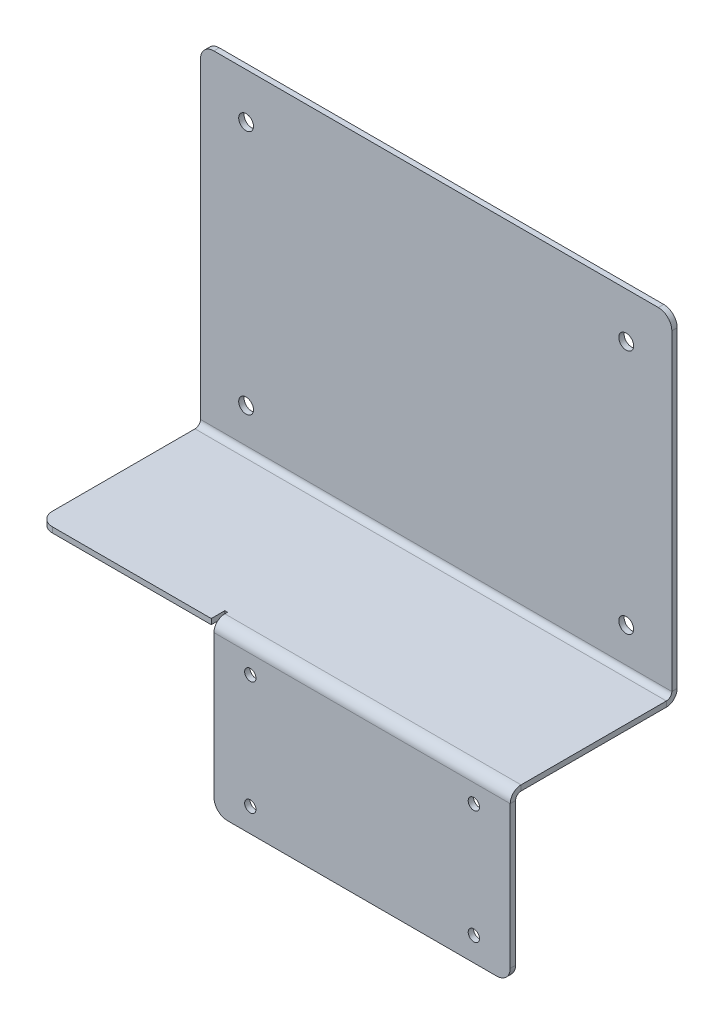
from build123d import *

# Parameters (mm, degrees)
SKETCH1_W                     = 175
SKETCH1_H                     = 125
SKETCH1_R                     = 2.75
BASE_FLANGE1_DEPTH            = 2
EDGE_FLANGE1_STRIP_W          = 12.06
EDGE_FLANGE1_STRIP_H          = 2
EDGE_FLANGE1_STRIP_CUT_DEPTH  = 175
EDGE_FLANGE1_DEPTH            = 175
EDGE_FLANGE3_STRIP_W          = 12.06
EDGE_FLANGE3_STRIP_H          = 2
EDGE_FLANGE3_STRIP_CUT_DEPTH  = 110
EDGE_FLANGE3_RELIEF_W         = 13.06
EDGE_FLANGE3_RELIEF_H         = 1
EDGE_FLANGE3_RELIEF_CUT_DEPTH = 2
EDGE_FLANGE3_DEPTH            = 110
CUT_EXTRUDE2_REACH            = 164.808
SKETCH18_R                    = 2.1
FILLET1_R                     = 5


# Sheet-metal steps are written as plain solids
with BuildPart() as part:
    # Sketch1 → Base-Flange1 (new body)
    with BuildSketch(Plane.XY):
        Rectangle(SKETCH1_W, SKETCH1_H)
        with Locations((70.5634, 45.5634)):
            Circle(SKETCH1_R, mode=Mode.SUBTRACT)
        with Locations((70.5634, -45.5634)):
            Circle(SKETCH1_R, mode=Mode.SUBTRACT)
        with Locations((-70.5634, 45.5634)):
            Circle(SKETCH1_R, mode=Mode.SUBTRACT)
        with Locations((-70.5634, -45.5634)):
            Circle(SKETCH1_R, mode=Mode.SUBTRACT)
    extrude(amount=BASE_FLANGE1_DEPTH)

    # Edge-Flange1 strip (across the edge) → Edge-Flange1 strip cut (cut)
    with BuildSketch(Plane(origin=(-87.5, -62.5, 2), x_dir=(0, 1, 0), z_dir=(1, 0, 0))):
        with Locations((-2, -1)):
            Rectangle(EDGE_FLANGE1_STRIP_W, EDGE_FLANGE1_STRIP_H)
    extrude(amount=EDGE_FLANGE1_STRIP_CUT_DEPTH, mode=Mode.SUBTRACT)

    # Edge-Flange1 section (across the edge) → Edge-Flange1 (add)
    with BuildSketch(Plane(origin=(-87.5, -62.5, 2), x_dir=(0, 1, 0), z_dir=(1, 0, 0))):
        with BuildLine():
            Line((0, 2.03), (0, 60))
            Line((0, 60), (2, 60))
            Line((2, 60), (2, 2.03))
            ThreePointArc((2, 2.03), (2.594573234, 0.594573234), (4.03, 0))
            Line((4.03, 0), (4.03, -2))
            ThreePointArc((4.03, -2), (1.180359672, -0.819640328), (0, 2.03))
        make_face()
    extrude(amount=EDGE_FLANGE1_DEPTH)

    # Edge-Flange3 strip (across the edge) → Edge-Flange3 strip cut (cut)
    with BuildSketch(Plane(origin=(87.5, -62.5, 62), x_dir=(0, 0, -1), z_dir=(-1, 0, 0))):
        with Locations((-2, -1)):
            Rectangle(EDGE_FLANGE3_STRIP_W, EDGE_FLANGE3_STRIP_H)
    extrude(amount=EDGE_FLANGE3_STRIP_CUT_DEPTH, mode=Mode.SUBTRACT)

    # Edge-Flange3 relief (on the sheet) → Edge-Flange3 relief cut (cut)
    with BuildSketch(Plane(origin=(87.5, -62.5, 57.97), x_dir=(0, 0, -1), z_dir=(0, -1, 0))):
        with Locations((-5.53, -110.5)):
            Rectangle(EDGE_FLANGE3_RELIEF_W, EDGE_FLANGE3_RELIEF_H)
    extrude(amount=-EDGE_FLANGE3_RELIEF_CUT_DEPTH, mode=Mode.SUBTRACT)

    # Edge-Flange3 section (across the edge) → Edge-Flange3 (add)
    with BuildSketch(Plane(origin=(87.5, -62.5, 62), x_dir=(0, 0, -1), z_dir=(-1, 0, 0))):
        with BuildLine():
            Line((0, 2.03), (0, 60))
            Line((0, 60), (2, 60))
            Line((2, 60), (2, 2.03))
            ThreePointArc((2, 2.03), (2.594573234, 0.594573234), (4.03, 0))
            Line((4.03, 0), (4.03, -2))
            ThreePointArc((4.03, -2), (1.180359672, -0.819640328), (0, 2.03))
        make_face()
    extrude(amount=EDGE_FLANGE3_DEPTH)

    # Sketch18 → Cut-Extrude2 (cut, up to next)
    with BuildSketch(Plane.XY.offset(62), mode=Mode.PRIVATE) as cut_extrude2_sk1:
        with Locations((-9, -71.372677549)):
            Circle(SKETCH18_R)
    cut_extrude2_tool1 = extrude(cut_extrude2_sk1.sketch, amount=-CUT_EXTRUDE2_REACH, mode=Mode.PRIVATE) & part.part
    # Sketch18 → Cut-Extrude2 (cut, up to next)
    with BuildSketch(Plane.XY.offset(62), mode=Mode.PRIVATE) as cut_extrude2_sk2:
        with Locations((-9, -113.627322451)):
            Circle(SKETCH18_R)
    cut_extrude2_tool2 = extrude(cut_extrude2_sk2.sketch, amount=-CUT_EXTRUDE2_REACH, mode=Mode.PRIVATE) & part.part
    # Sketch18 → Cut-Extrude2 (cut, up to next)
    with BuildSketch(Plane.XY.offset(62), mode=Mode.PRIVATE) as cut_extrude2_sk3:
        with Locations((74, -71.372677549)):
            Circle(SKETCH18_R)
    cut_extrude2_tool3 = extrude(cut_extrude2_sk3.sketch, amount=-CUT_EXTRUDE2_REACH, mode=Mode.PRIVATE) & part.part
    # Sketch18 → Cut-Extrude2 (cut, up to next)
    with BuildSketch(Plane.XY.offset(62), mode=Mode.PRIVATE) as cut_extrude2_sk4:
        with Locations((74, -113.627322451)):
            Circle(SKETCH18_R)
    cut_extrude2_tool4 = extrude(cut_extrude2_sk4.sketch, amount=-CUT_EXTRUDE2_REACH, mode=Mode.PRIVATE) & part.part
    add(cut_extrude2_tool1.solids().sort_by_distance((-9, -71.372678, 62))[0], mode=Mode.SUBTRACT)
    add(cut_extrude2_tool2.solids().sort_by_distance((-9, -113.627322, 62))[0], mode=Mode.SUBTRACT)
    add(cut_extrude2_tool3.solids().sort_by_distance((74, -71.372678, 62))[0], mode=Mode.SUBTRACT)
    add(cut_extrude2_tool4.solids().sort_by_distance((74, -113.627322, 62))[0], mode=Mode.SUBTRACT)

    # Fillet1
    fillet1_edges = [part.edges().sort_by_distance(p)[0] for p in [
        (-87.5, -61.5, 62),
        (87.5, 62.5, 1),
        (-87.5, 62.5, 1),
        (87.5, -122.5, 61),
        (-22.5, -122.5, 61),
    ]]
    fillet(fillet1_edges, radius=FILLET1_R)


solid = part.part
